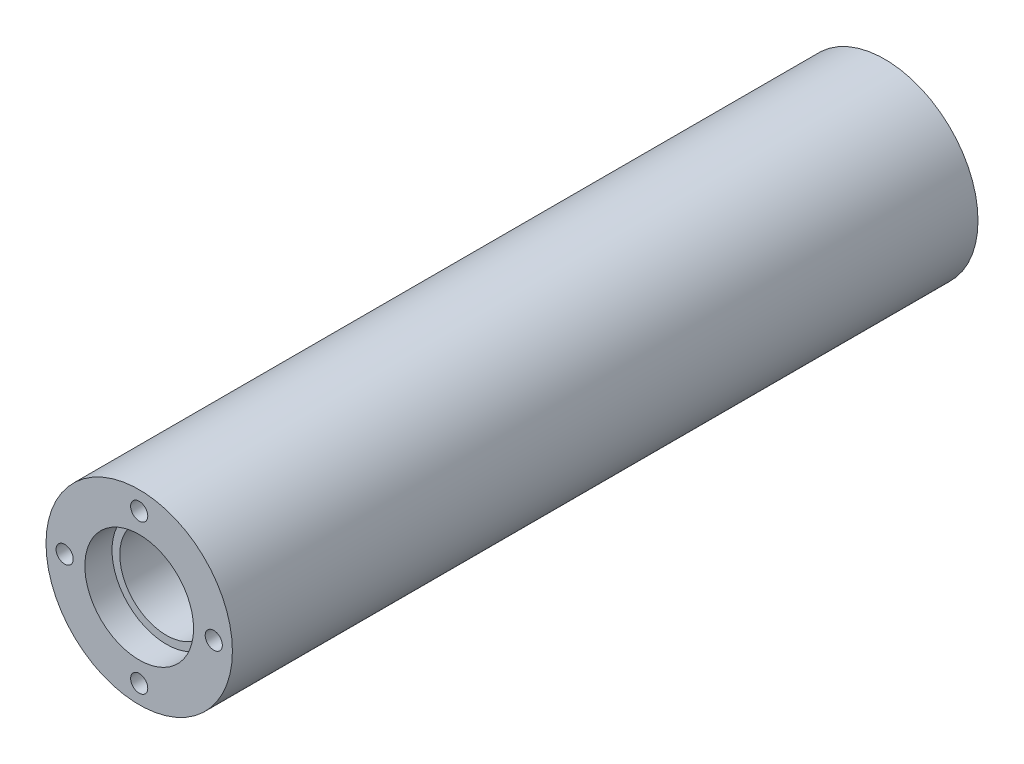
from build123d import *

# Parameters (mm, degrees)
SKETCH1_R           = 19.05
SKETCH1_R_2         = 9.525
BOSS_EXTRUDE1_DEPTH = 152.4
SKETCH2_R           = 1.7526
CUT_EXTRUDE1_DEPTH  = 9.525
CUT_EXTRUDE2_START  = -9.525
SKETCH3_R           = 1.7526
CUT_EXTRUDE2_DEPTH  = 9.525
SKETCH6_R           = 11.1125
CUT_EXTRUDE3_DEPTH  = 5.55625
CUT_EXTRUDE4_START  = -5.55625
SKETCH7_R           = 11.1125
CUT_EXTRUDE4_DEPTH  = 5.55625


with BuildPart() as part:
    # Sketch1 → Boss-Extrude1 (new body)
    with BuildSketch(Plane.XY):
        Circle(SKETCH1_R)
        Circle(SKETCH1_R_2, mode=Mode.SUBTRACT)
    extrude(amount=BOSS_EXTRUDE1_DEPTH)

    # Sketch2 → Cut-Extrude1 (cut)
    with BuildSketch(Plane(origin=(0, 0, 0), x_dir=(-1, 0, 0), z_dir=(0, 0, -1))):
        with Locations((0, 15.24)):
            Circle(SKETCH2_R)
        with Locations((15.24, 0)):
            Circle(SKETCH2_R)
        with Locations((0, -15.24)):
            Circle(SKETCH2_R)
        with Locations((-15.24, 0)):
            Circle(SKETCH2_R)
    extrude(amount=-CUT_EXTRUDE1_DEPTH, mode=Mode.SUBTRACT)

    # Sketch3 → Cut-Extrude2 (cut)
    with BuildSketch(Plane.XY.offset(152.4).offset(CUT_EXTRUDE2_START)):
        with Locations((0, 15.24)):
            Circle(SKETCH3_R)
        with Locations((15.24, 0)):
            Circle(SKETCH3_R)
        with Locations((0, -15.24)):
            Circle(SKETCH3_R)
        with Locations((-15.24, 0)):
            Circle(SKETCH3_R)
    extrude(amount=CUT_EXTRUDE2_DEPTH, mode=Mode.SUBTRACT)

    # Sketch6 → Cut-Extrude3 (cut)
    with BuildSketch(Plane.XY.offset(152.4)):
        Circle(SKETCH6_R)
    extrude(amount=-CUT_EXTRUDE3_DEPTH, mode=Mode.SUBTRACT)

    # Sketch7 → Cut-Extrude4 (cut)
    with BuildSketch(Plane(origin=(0, 0, 0), x_dir=(-1, 0, 0), z_dir=(0, 0, -1)).offset(CUT_EXTRUDE4_START)):
        Circle(SKETCH7_R)
    extrude(amount=CUT_EXTRUDE4_DEPTH, mode=Mode.SUBTRACT)


solid = part.part
